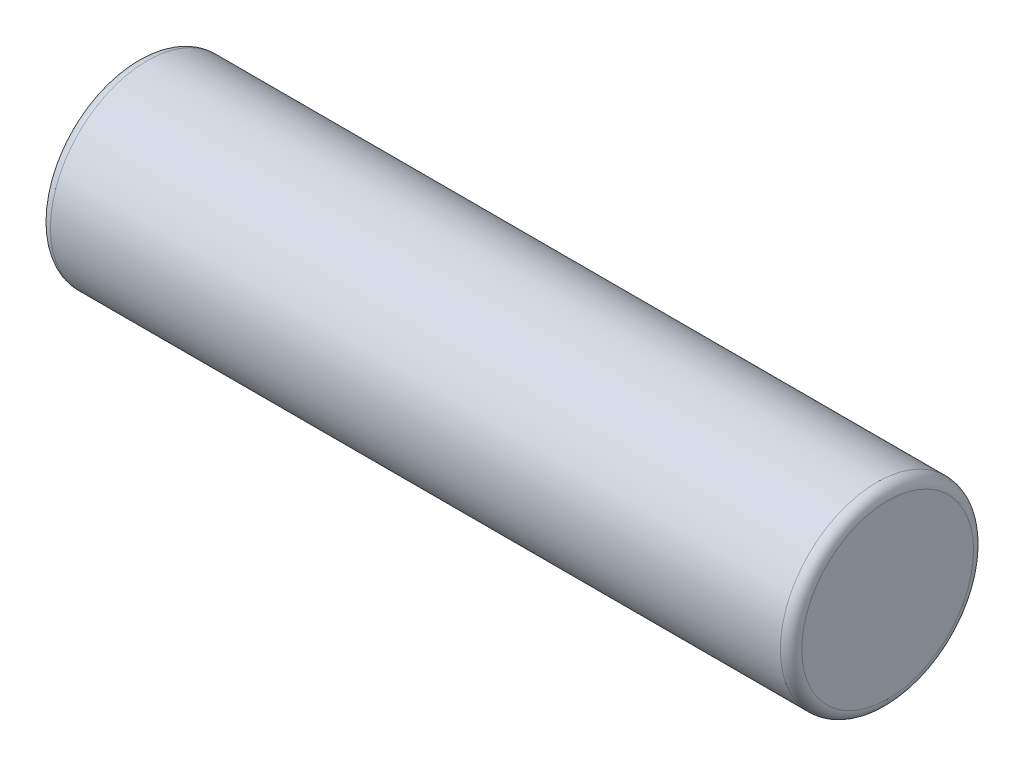
from build123d import *

# Parameters (mm, degrees)
SKETCH3_W = 70
SKETCH3_H = 9
FILLET1_R = 1


with BuildPart() as part:
    # Sketch3 → Revolve2 (revolve)
    with BuildSketch(Plane(origin=(0, 0, 0), x_dir=(1, 0, 0), z_dir=(0, 1, 0))):
        Rectangle(SKETCH3_W, SKETCH3_H)
    revolve(axis=Axis((-35, 0, 4.5), (1, 0, 0)))

    # Fillet1
    fillet1_edges = [part.edges().sort_by_distance(p)[0] for p in [
        (35, 0, 13.5),
        (-35, 0, 13.5),
    ]]
    fillet(fillet1_edges, radius=FILLET1_R)


solid = part.part
